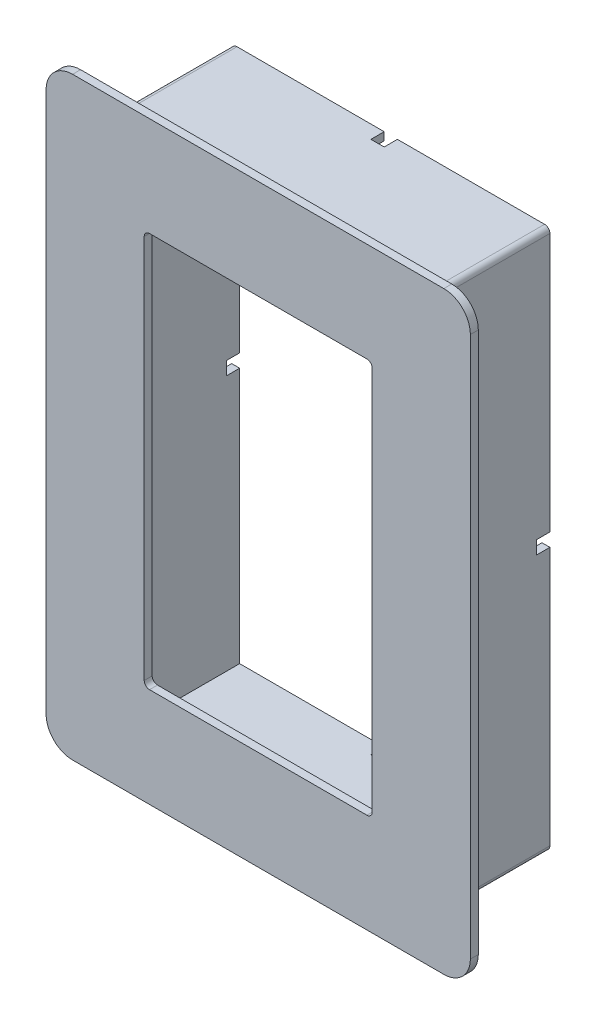
from build123d import *

# Parameters (mm, degrees)
ESBO_O1_W                = 120
ESBO_O1_H                = 204
RESSALTO_EXTRUS_O1_DEPTH = 50
ESBO_O2_W                = 114
ESBO_O2_H                = 198
CORTE_EXTRUS_O1_DEPTH    = 47
ESBO_O4_W                = 86
ESBO_O4_H                = 149
CORTE_EXTRUS_O2_DEPTH    = 45
ESBO_O7_W                = 3
ESBO_O7_H                = 204
RESSALTO_EXTRUS_O2_DEPTH = 20
ESBO_O12_W               = 3
ESBO_O12_H               = 204
RESSALTO_EXTRUS_O3_DEPTH = 20
ESBO_O13_W               = 160
ESBO_O13_H               = 3
RESSALTO_EXTRUS_O4_DEPTH = 10
ESBO_O14_W               = 160
ESBO_O14_H               = 3
RESSALTO_EXTRUS_O5_DEPTH = 10
FILETE1_R                = 10
ESBO_O15_W               = 3
ESBO_O15_H               = 5
ESBO_O15_W_2             = 5
ESBO_O15_H_2             = 3
CORTE_EXTRUS_O4_DEPTH    = 5
FILETE2_R                = 10
FILETE3_R                = 10
FILETE4_R                = 10
FILETE5_R                = 2
FILETE6_R                = 2
FILETE8_R                = 2


with BuildPart() as part:
    # Esboço1 → Ressalto-extrusão1 (new body)
    with BuildSketch(Plane.XY):
        with Locations((27.324641181, 48.820153307)):
            Rectangle(ESBO_O1_W, ESBO_O1_H)
    extrude(amount=RESSALTO_EXTRUS_O1_DEPTH)

    # Esboço2 → Corte-extrusão1 (cut)
    with BuildSketch(Plane(origin=(0, 0, 0), x_dir=(-1, 0, 0), z_dir=(0, 0, -1))):
        with Locations((-27.324641181, 48.820153307)):
            Rectangle(ESBO_O2_W, ESBO_O2_H)
    extrude(amount=-CORTE_EXTRUS_O1_DEPTH, mode=Mode.SUBTRACT)

    # Esboço4 → Corte-extrusão2 (cut)
    with BuildSketch(Plane.XY.offset(50)):
        with Locations((27.324641181, 48.820153307)):
            Rectangle(ESBO_O4_W, ESBO_O4_H)
    extrude(amount=-CORTE_EXTRUS_O2_DEPTH, mode=Mode.SUBTRACT)

    # Esboço7 → Ressalto-extrusão2 (add)
    with BuildSketch(Plane(origin=(87.324641181, 0, 0), x_dir=(0, 0, -1), z_dir=(1, 0, 0))):
        with Locations((-48.5, 48.820153307)):
            Rectangle(ESBO_O7_W, ESBO_O7_H)
    extrude(amount=RESSALTO_EXTRUS_O2_DEPTH)

    # Esboço12 → Ressalto-extrusão3 (add)
    with BuildSketch(Plane.ZY.offset(32.675358819)):
        with Locations((48.5, 48.820153307)):
            Rectangle(ESBO_O12_W, ESBO_O12_H)
    extrude(amount=RESSALTO_EXTRUS_O3_DEPTH)

    # Esboço13 → Ressalto-extrusão4 (add)
    with BuildSketch(Plane(origin=(0, 150.820153307, 0), x_dir=(1, 0, 0), z_dir=(0, 1, 0))):
        with Locations((27.324641181, -48.5)):
            Rectangle(ESBO_O13_W, ESBO_O13_H)
    extrude(amount=RESSALTO_EXTRUS_O4_DEPTH)

    # Esboço14 → Ressalto-extrusão5 (add)
    with BuildSketch(Plane.XZ.offset(53.179846693)):
        with Locations((27.324641181, 48.5)):
            Rectangle(ESBO_O14_W, ESBO_O14_H)
    extrude(amount=RESSALTO_EXTRUS_O5_DEPTH)

    # Filete1
    filete1_edges = [part.edges().sort_by_distance(p)[0] for p in [
        (107.324641181, 160.820153307, 48.5),
    ]]
    fillet(filete1_edges, radius=FILETE1_R)

    # Esboço15 → Corte-extrusão4 (cut)
    with BuildSketch(Plane(origin=(0, 0, 0), x_dir=(-1, 0, 0), z_dir=(0, 0, -1))):
        with Locations((31.175358819, 48.820153307)):
            Rectangle(ESBO_O15_W, ESBO_O15_H)
        with Locations((-27.324641181, 149.320153307)):
            Rectangle(ESBO_O15_W_2, ESBO_O15_H_2)
        with Locations((-27.324641181, -51.679846693)):
            Rectangle(ESBO_O15_W_2, ESBO_O15_H_2)
        with Locations((-85.824641181, 48.820153307)):
            Rectangle(ESBO_O15_W, ESBO_O15_H)
    extrude(amount=-CORTE_EXTRUS_O4_DEPTH, mode=Mode.SUBTRACT)

    # Filete2
    filete2_edges = [part.edges().sort_by_distance(p)[0] for p in [
        (-52.675358819, 160.820153307, 48.5),
    ]]
    fillet(filete2_edges, radius=FILETE2_R)

    # Filete3
    filete3_edges = [part.edges().sort_by_distance(p)[0] for p in [
        (107.324641181, -63.179846693, 48.5),
    ]]
    fillet(filete3_edges, radius=FILETE3_R)

    # Filete4
    filete4_edges = [part.edges().sort_by_distance(p)[0] for p in [
        (-52.675358819, -63.179846693, 48.5),
    ]]
    fillet(filete4_edges, radius=FILETE4_R)

    # Filete5
    filete5_edges = [part.edges().sort_by_distance(p)[0] for p in [
        (-32.675358819, -53.179846693, 23.5),
    ]]
    fillet(filete5_edges, radius=FILETE5_R)

    # Filete6
    filete6_edges = [part.edges().sort_by_distance(p)[0] for p in [
        (-32.675358819, 150.820153307, 23.5),
        (87.324641181, 150.820153307, 23.5),
        (87.324641181, -53.179846693, 23.5),
    ]]
    fillet(filete6_edges, radius=FILETE6_R)

    # Filete8
    filete8_edges = [part.edges().sort_by_distance(p)[0] for p in [
        (70.324641181, 123.320153307, 48.5),
        (70.324641181, -25.679846693, 48.5),
        (-15.675358819, -25.679846693, 48.5),
        (-15.675358819, 123.320153307, 48.5),
    ]]
    fillet(filete8_edges, radius=FILETE8_R)


solid = part.part
